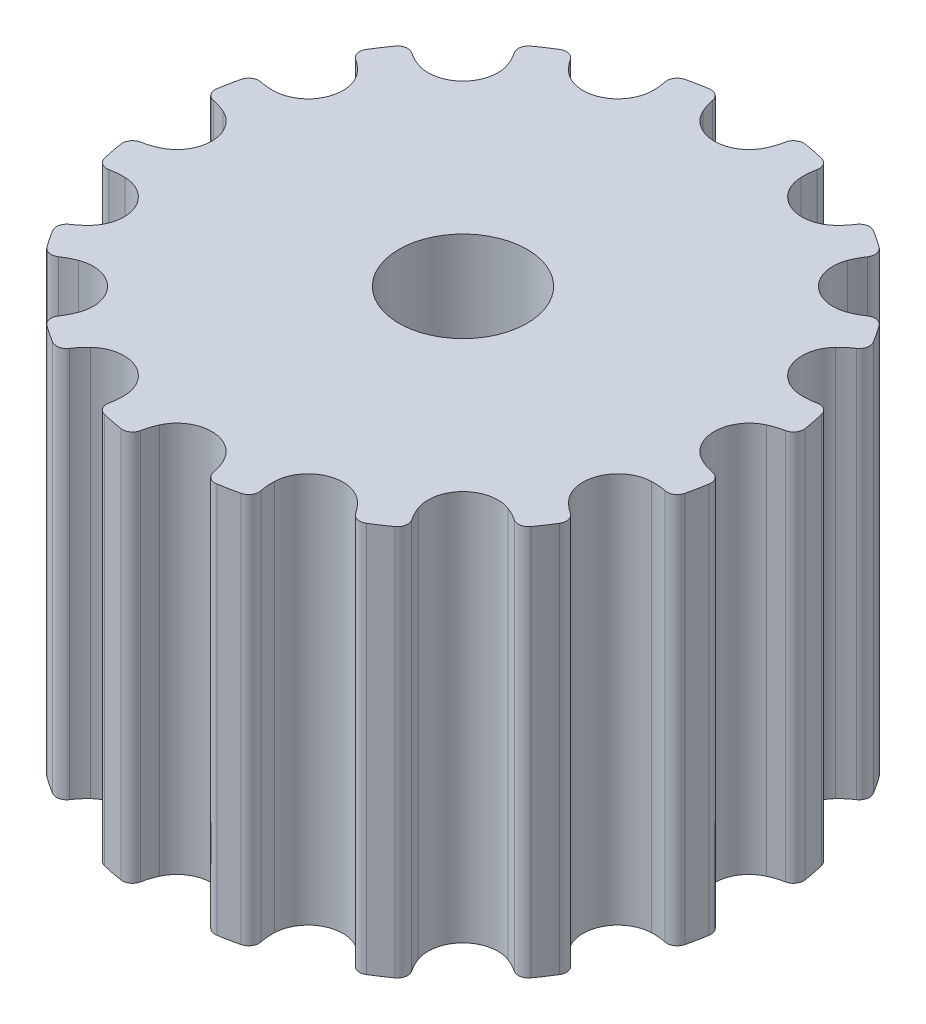
from build123d import *

# Parameters (mm, degrees)
SKETCH1_R           = 1.5625
BOSS_EXTRUDE1_DEPTH = 4.7625


with BuildPart() as part:
    # Sketch1 → Boss-Extrude1 (new, symmetric)
    with BuildSketch(Plane(origin=(0, 0, 0), x_dir=(1, 0, 0), z_dir=(0, 1, 0))):
        with BuildLine():
            ThreePointArc((-1.850768, -6.777037356), (-1.816941892, -6.962421006), (-1.663291889, -7.071521784))
            ThreePointArc((-1.663291889, -7.071521784), (-1.417233644, -7.124914669), (-1.169472895, -7.169748489))
            ThreePointArc((-1.169472895, -7.169748489), (-0.985767742, -7.127751824), (-0.883573242, -6.969424355))
            ThreePointArc((-0.883573242, -6.969424355), (-0.839120956, -6.792881518), (-0.773880597, -6.622919538))
            ThreePointArc((-0.773880597, -6.622919538), (0, -6.1245), (0.773880597, -6.622919538))
            ThreePointArc((0.773880597, -6.622919538), (0.839120956, -6.792881518), (0.883573242, -6.969424355))
            ThreePointArc((0.883573242, -6.969424355), (0.985767742, -7.127751824), (1.169472895, -7.169748489))
            ThreePointArc((1.169472895, -7.169748489), (1.417233644, -7.124914669), (1.663291889, -7.071521784))
            ThreePointArc((1.663291889, -7.071521784), (1.816941892, -6.962421006), (1.850768, -6.777037356))
            ThreePointArc((1.850768, -6.777037356), (1.824276538, -6.596921889), (1.819509137, -6.414931089))
            ThreePointArc((1.819509137, -6.414931089), (2.343744682, -5.658300197), (3.249454025, -5.822628523))
            ThreePointArc((3.249454025, -5.822628523), (3.374769892, -5.954686513), (3.483398468, -6.100779674))
            ThreePointArc((3.483398468, -6.100779674), (3.638403174, -6.20794704), (3.824196033, -6.176445981))
            ThreePointArc((3.824196033, -6.176445981), (4.035939958, -6.040210999), (4.242835561, -5.896719991))
            ThreePointArc((4.242835561, -5.896719991), (4.343038594, -5.737124705), (4.303346591, -5.552907854))
            ThreePointArc((4.303346591, -5.552907854), (4.209944466, -5.396640704), (4.135895098, -5.230327534))
            ThreePointArc((4.135895098, -5.230327534), (4.330675481, -4.330675481), (5.230327534, -4.135895098))
            ThreePointArc((5.230327534, -4.135895098), (5.396640704, -4.209944466), (5.552907854, -4.303346591))
            ThreePointArc((5.552907854, -4.303346591), (5.737124705, -4.343038594), (5.896719991, -4.242835561))
            ThreePointArc((5.896719991, -4.242835561), (6.040210999, -4.035939958), (6.176445981, -3.824196033))
            ThreePointArc((6.176445981, -3.824196033), (6.20794704, -3.638403174), (6.100779674, -3.483398468))
            ThreePointArc((6.100779674, -3.483398468), (5.954686513, -3.374769892), (5.822628523, -3.249454025))
            ThreePointArc((5.822628523, -3.249454025), (5.658300197, -2.343744682), (6.414931089, -1.819509137))
            ThreePointArc((6.414931089, -1.819509137), (6.596921889, -1.824276538), (6.777037356, -1.850768))
            ThreePointArc((6.777037356, -1.850768), (6.962421006, -1.816941892), (7.071521784, -1.663291889))
            ThreePointArc((7.071521784, -1.663291889), (7.124914669, -1.417233644), (7.169748489, -1.169472895))
            ThreePointArc((7.169748489, -1.169472895), (7.127751824, -0.985767742), (6.969424355, -0.883573242))
            ThreePointArc((6.969424355, -0.883573242), (6.792881518, -0.839120956), (6.622919538, -0.773880597))
            ThreePointArc((6.622919538, -0.773880597), (6.1245, 0), (6.622919538, 0.773880597))
            ThreePointArc((6.622919538, 0.773880597), (6.792881518, 0.839120956), (6.969424355, 0.883573242))
            ThreePointArc((6.969424355, 0.883573242), (7.127751824, 0.985767742), (7.169748489, 1.169472895))
            ThreePointArc((7.169748489, 1.169472895), (7.124914669, 1.417233644), (7.071521784, 1.663291889))
            ThreePointArc((7.071521784, 1.663291889), (6.962421006, 1.816941892), (6.777037356, 1.850768))
            ThreePointArc((6.777037356, 1.850768), (6.596921889, 1.824276538), (6.414931089, 1.819509137))
            ThreePointArc((6.414931089, 1.819509137), (5.658300197, 2.343744682), (5.822628523, 3.249454025))
            ThreePointArc((5.822628523, 3.249454025), (5.954686513, 3.374769892), (6.100779674, 3.483398468))
            ThreePointArc((6.100779674, 3.483398468), (6.20794704, 3.638403174), (6.176445981, 3.824196033))
            ThreePointArc((6.176445981, 3.824196033), (6.040210999, 4.035939958), (5.896719991, 4.242835561))
            ThreePointArc((5.896719991, 4.242835561), (5.737124705, 4.343038594), (5.552907854, 4.303346591))
            ThreePointArc((5.552907854, 4.303346591), (5.396640704, 4.209944466), (5.230327534, 4.135895098))
            ThreePointArc((5.230327534, 4.135895098), (4.330675481, 4.330675481), (4.135895098, 5.230327534))
            ThreePointArc((4.135895098, 5.230327534), (4.209944466, 5.396640704), (4.303346591, 5.552907854))
            ThreePointArc((4.303346591, 5.552907854), (4.343038594, 5.737124705), (4.242835561, 5.896719991))
            ThreePointArc((4.242835561, 5.896719991), (4.035939958, 6.040210999), (3.824196033, 6.176445981))
            ThreePointArc((3.824196033, 6.176445981), (3.638403174, 6.20794704), (3.483398468, 6.100779674))
            ThreePointArc((3.483398468, 6.100779674), (3.374769892, 5.954686513), (3.249454025, 5.822628523))
            ThreePointArc((3.249454025, 5.822628523), (2.343744682, 5.658300197), (1.819509137, 6.414931089))
            ThreePointArc((1.819509137, 6.414931089), (1.824276538, 6.596921889), (1.850768, 6.777037356))
            ThreePointArc((1.850768, 6.777037356), (1.816941892, 6.962421006), (1.663291889, 7.071521784))
            ThreePointArc((1.663291889, 7.071521784), (1.417233644, 7.124914669), (1.169472895, 7.169748489))
            ThreePointArc((1.169472895, 7.169748489), (0.985767742, 7.127751824), (0.883573242, 6.969424355))
            ThreePointArc((0.883573242, 6.969424355), (0.839120956, 6.792881518), (0.773880597, 6.622919538))
            ThreePointArc((0.773880597, 6.622919538), (0, 6.1245), (-0.773880597, 6.622919538))
            ThreePointArc((-0.773880597, 6.622919538), (-0.839120956, 6.792881518), (-0.883573242, 6.969424355))
            ThreePointArc((-0.883573242, 6.969424355), (-0.985767742, 7.127751824), (-1.169472895, 7.169748489))
            ThreePointArc((-1.169472895, 7.169748489), (-1.417233644, 7.124914669), (-1.663291889, 7.071521784))
            ThreePointArc((-1.663291889, 7.071521784), (-1.816941892, 6.962421006), (-1.850768, 6.777037356))
            ThreePointArc((-1.850768, 6.777037356), (-1.824276538, 6.596921889), (-1.819509137, 6.414931089))
            ThreePointArc((-1.819509137, 6.414931089), (-2.343744682, 5.658300197), (-3.249454025, 5.822628523))
            ThreePointArc((-3.249454025, 5.822628523), (-3.374769892, 5.954686513), (-3.483398468, 6.100779674))
            ThreePointArc((-3.483398468, 6.100779674), (-3.638403174, 6.20794704), (-3.824196033, 6.176445981))
            ThreePointArc((-3.824196033, 6.176445981), (-4.035939958, 6.040210999), (-4.242835561, 5.896719991))
            ThreePointArc((-4.242835561, 5.896719991), (-4.343038594, 5.737124705), (-4.303346591, 5.552907854))
            ThreePointArc((-4.303346591, 5.552907854), (-4.209944466, 5.396640704), (-4.135895098, 5.230327534))
            ThreePointArc((-4.135895098, 5.230327534), (-4.330675481, 4.330675481), (-5.230327534, 4.135895098))
            ThreePointArc((-5.230327534, 4.135895098), (-5.396640704, 4.209944466), (-5.552907854, 4.303346591))
            ThreePointArc((-5.552907854, 4.303346591), (-5.737124705, 4.343038594), (-5.896719991, 4.242835561))
            ThreePointArc((-5.896719991, 4.242835561), (-6.040210999, 4.035939958), (-6.176445981, 3.824196033))
            ThreePointArc((-6.176445981, 3.824196033), (-6.20794704, 3.638403174), (-6.100779674, 3.483398468))
            ThreePointArc((-6.100779674, 3.483398468), (-5.954686513, 3.374769892), (-5.822628523, 3.249454025))
            ThreePointArc((-5.822628523, 3.249454025), (-5.658300197, 2.343744682), (-6.414931089, 1.819509137))
            ThreePointArc((-6.414931089, 1.819509137), (-6.596921889, 1.824276538), (-6.777037356, 1.850768))
            ThreePointArc((-6.777037356, 1.850768), (-6.962421006, 1.816941892), (-7.071521784, 1.663291889))
            ThreePointArc((-7.071521784, 1.663291889), (-7.124914669, 1.417233644), (-7.169748489, 1.169472895))
            ThreePointArc((-7.169748489, 1.169472895), (-7.127751824, 0.985767742), (-6.969424355, 0.883573242))
            ThreePointArc((-6.969424355, 0.883573242), (-6.792881518, 0.839120956), (-6.622919538, 0.773880597))
            ThreePointArc((-6.622919538, 0.773880597), (-6.1245, 0), (-6.622919538, -0.773880597))
            ThreePointArc((-6.622919538, -0.773880597), (-6.792881518, -0.839120956), (-6.969424355, -0.883573242))
            ThreePointArc((-6.969424355, -0.883573242), (-7.127751824, -0.985767742), (-7.169748489, -1.169472895))
            ThreePointArc((-7.169748489, -1.169472895), (-7.124914669, -1.417233644), (-7.071521784, -1.663291889))
            ThreePointArc((-7.071521784, -1.663291889), (-6.962421006, -1.816941892), (-6.777037356, -1.850768))
            ThreePointArc((-6.777037356, -1.850768), (-6.596921889, -1.824276538), (-6.414931089, -1.819509137))
            ThreePointArc((-6.414931089, -1.819509137), (-5.658300197, -2.343744682), (-5.822628523, -3.249454025))
            ThreePointArc((-5.822628523, -3.249454025), (-5.954686513, -3.374769892), (-6.100779674, -3.483398468))
            ThreePointArc((-6.100779674, -3.483398468), (-6.20794704, -3.638403174), (-6.176445981, -3.824196033))
            ThreePointArc((-6.176445981, -3.824196033), (-6.040210999, -4.035939958), (-5.896719991, -4.242835561))
            ThreePointArc((-5.896719991, -4.242835561), (-5.737124705, -4.343038594), (-5.552907854, -4.303346591))
            ThreePointArc((-5.552907854, -4.303346591), (-5.396640704, -4.209944466), (-5.230327534, -4.135895098))
            ThreePointArc((-5.230327534, -4.135895098), (-4.330675481, -4.330675481), (-4.135895098, -5.230327534))
            ThreePointArc((-4.135895098, -5.230327534), (-4.209944466, -5.396640704), (-4.303346591, -5.552907854))
            ThreePointArc((-4.303346591, -5.552907854), (-4.343038594, -5.737124705), (-4.242835561, -5.896719991))
            ThreePointArc((-4.242835561, -5.896719991), (-4.035939958, -6.040210999), (-3.824196033, -6.176445981))
            ThreePointArc((-3.824196033, -6.176445981), (-3.638403174, -6.20794704), (-3.483398468, -6.100779674))
            ThreePointArc((-3.483398468, -6.100779674), (-3.374769892, -5.954686513), (-3.249454025, -5.822628523))
            ThreePointArc((-3.249454025, -5.822628523), (-2.343744682, -5.658300197), (-1.819509137, -6.414931089))
            ThreePointArc((-1.819509137, -6.414931089), (-1.824276538, -6.596921889), (-1.850768, -6.777037356))
        make_face()
        Circle(SKETCH1_R, mode=Mode.SUBTRACT)
    extrude(amount=BOSS_EXTRUDE1_DEPTH, both=True)


solid = part.part
